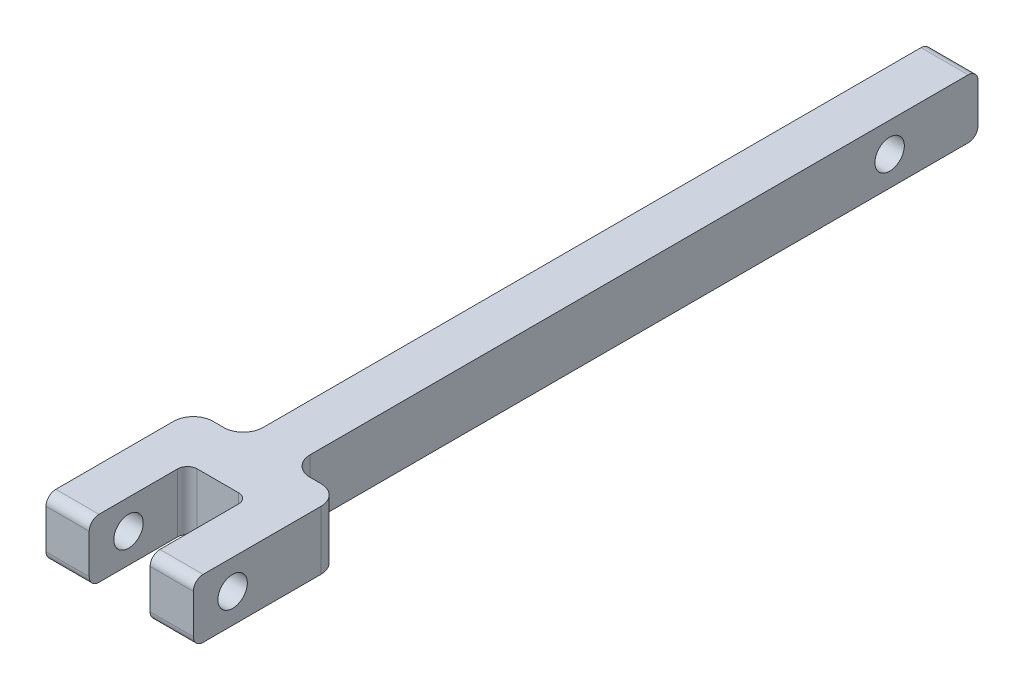
from build123d import *
from build123d.topology import SkipClean

# Parameters (mm, degrees)
SALIENTE_EXTRUIR1_DEPTH    = 2.4
CORTAR_EXTRUIR1_DEPTH      = 43.673293756
CORTAR_EXTRUIR1_DEPTH_BACK = 43.673293756
CROQUIS2_R                 = 1.5
CROQUIS3_R                 = 1.5
SALIENTE_EXTRUIR2_DEPTH    = 7.5
CORTAR_EXTRUIR2_DEPTH      = 3.1
REDONDEO1_R                = 2
REDONDEO2_R                = 1


with BuildPart() as part:
    # Croquis1 → Saliente-Extruir1 (new, symmetric)
    with BuildSketch(Plane(origin=(0, 0, 0), x_dir=(0, 0, -1), z_dir=(1, 0, 0))):
        with BuildLine():
            Line((-41.5, 3), (41.5, 3))
            ThreePointArc((41.5, 3), (42.207106781, 2.707106781), (42.5, 2))
            Line((42.5, 2), (42.5, -2))
            ThreePointArc((42.5, -2), (42.207106781, -2.707106781), (41.5, -3))
            Line((41.5, -3), (-41.5, -3))
            ThreePointArc((-41.5, -3), (-42.207106781, -2.707106781), (-42.5, -2))
            Line((-42.5, -2), (-42.5, 2))
            ThreePointArc((-42.5, 2), (-42.207106781, 2.707106781), (-41.5, 3))
        make_face()
    extrude(amount=SALIENTE_EXTRUIR1_DEPTH, both=True)

    # Croquis2 → Cortar-Extruir1 (cut, two sides: drawn at the far end of the back side and taken through both)
    with BuildSketch(Plane(origin=(0, 0, 0), x_dir=(0, 0, -1), z_dir=(1, 0, 0)).offset(-CORTAR_EXTRUIR1_DEPTH_BACK)):
        with Locations((-38.5, 0)):
            Circle(CROQUIS2_R)
        with Locations((33.5, 0)):
            Circle(CROQUIS2_R)
    extrude(amount=CORTAR_EXTRUIR1_DEPTH + CORTAR_EXTRUIR1_DEPTH_BACK, mode=Mode.SUBTRACT)

    # Croquis3 → Saliente-Extruir2 (add, symmetric)
    with SkipClean():  # the faces are left unmerged after this step: merging them gives an invalid solid
        with BuildSketch(Plane(origin=(0, 0, 0), x_dir=(0, 0, -1), z_dir=(1, 0, 0))):
            with BuildLine():
                Line((-42.5, 2), (-42.5, -2))
                ThreePointArc((-42.5, -2), (-42.207106781, -2.707106781), (-41.5, -3))
                Line((-41.5, -3), (-27.5, -3))
                Line((-27.5, -3), (-27.5, 3))
                Line((-27.5, 3), (-41.5, 3))
                ThreePointArc((-41.5, 3), (-42.207106781, 2.707106781), (-42.5, 2))
            make_face()
            with Locations((-38.5, 0)):
                Circle(CROQUIS3_R, mode=Mode.SUBTRACT)
        extrude(amount=SALIENTE_EXTRUIR2_DEPTH, both=True)
    add(part.part.scale(1), mode=Mode.REPLACE)  # the faces are merged on a copy

    # Croquis4 → Cortar-Extruir2 (cut, symmetric)
    with BuildSketch(Plane(origin=(0, 0, 0), x_dir=(0, 0, -1), z_dir=(1, 0, 0))):
        with BuildLine():
            Line((-41.5, 3), (-32.5, 3))
            Line((-32.5, 3), (-32.5, -3))
            Line((-32.5, -3), (-41.5, -3))
            ThreePointArc((-41.5, -3), (-42.207106781, -2.707106781), (-42.5, -2))
            Line((-42.5, -2), (-42.5, 2))
            ThreePointArc((-42.5, 2), (-42.207106781, 2.707106781), (-41.5, 3))
        make_face()
    extrude(amount=CORTAR_EXTRUIR2_DEPTH, both=True, mode=Mode.SUBTRACT)

    # Redondeo1
    redondeo1_edges = [part.edges().sort_by_distance(p)[0] for p in [
        (2.4, 0, 27.5),
        (-2.4, 0, 27.5),
        (7.5, 0, 27.5),
        (-7.5, 0, 27.5),
    ]]
    fillet(redondeo1_edges, radius=REDONDEO1_R)

    # Redondeo2
    redondeo2_edges = [part.edges().sort_by_distance(p)[0] for p in [
        (3.1, 0, 32.5),
        (-3.1, 0, 32.5),
    ]]
    fillet(redondeo2_edges, radius=REDONDEO2_R)


solid = part.part
